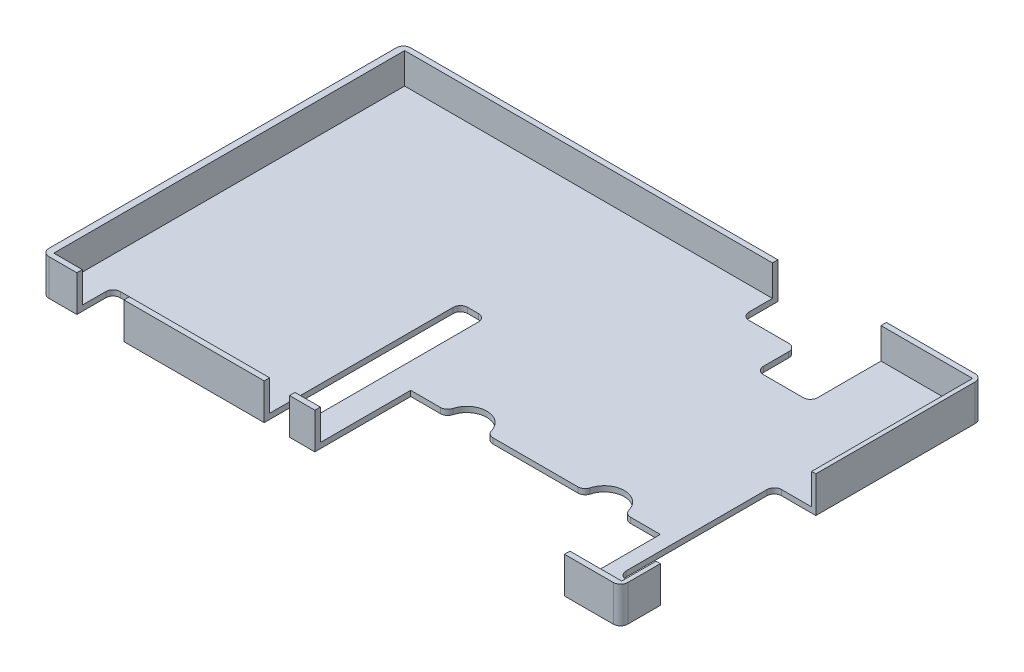
from build123d import *

# Parameters (mm, degrees)
SKETCH1_W           = 160
SKETCH1_H           = 100
BOSS_EXTRUDE1_DEPTH = 1.5
SKETCH2_W           = 160
SKETCH2_H           = 100
SKETCH2_W_2         = 157
SKETCH2_H_2         = 97
BOSS_EXTRUDE2_DEPTH = 10
FILLET1_R           = 2
SKETCH4_W           = 15
SKETCH4_H           = 21
CUT_EXTRUDE1_DEPTH  = 189.944436277
SKETCH5_W           = 69
SKETCH5_H           = 26.5
CUT_EXTRUDE2_DEPTH  = 189.944436277
SKETCH6_W           = 11.5
SKETCH6_H           = 43
CUT_EXTRUDE3_DEPTH  = 189.944436277
SKETCH7_W           = 7
SKETCH7_H           = 55
CUT_EXTRUDE4_DEPTH  = 10
CUT_EXTRUDE5_DEPTH  = 10
FILLET2_R           = 2
SKETCH10_W          = 13
SKETCH10_H          = 10
CUT_EXTRUDE6_DEPTH  = 10
FILLET3_R           = 2
FILLET4_R           = 2
SKETCH11_W          = 15
SKETCH11_H          = 10
CUT_EXTRUDE7_DEPTH  = 10
FILLET5_R           = 2


with BuildPart() as part:
    # Sketch1 → Boss-Extrude1 (new body)
    with BuildSketch(Plane(origin=(0, 0, 0), x_dir=(1, 0, 0), z_dir=(0, 1, 0))):
        with Locations((80, 50)):
            Rectangle(SKETCH1_W, SKETCH1_H)
    extrude(amount=BOSS_EXTRUDE1_DEPTH)

    # Sketch2 → Boss-Extrude2 (add)
    with BuildSketch(Plane(origin=(0, 0, 0), x_dir=(1, 0, 0), z_dir=(0, 1, 0))):
        with Locations((80, 50)):
            Rectangle(SKETCH2_W, SKETCH2_H)
        with Locations((80.326409395, 50)):
            Rectangle(SKETCH2_W_2, SKETCH2_H_2, mode=Mode.SUBTRACT)
    extrude(amount=BOSS_EXTRUDE2_DEPTH)

    # Fillet1
    fillet1_edges = [part.edges().sort_by_distance(p)[0] for p in [
        (0, 5, -100),
        (160, 5, -100),
        (160, 5, 0),
        (0, 5, 0),
    ]]
    fillet(fillet1_edges, radius=FILLET1_R)

    # Sketch4 → Cut-Extrude1 (cut, through all)
    with BuildSketch(Plane.XZ):
        with Locations((126, -89.5)):
            Rectangle(SKETCH4_W, SKETCH4_H)
    extrude(amount=-CUT_EXTRUDE1_DEPTH, mode=Mode.SUBTRACT)

    # Sketch5 → Cut-Extrude2 (cut, through all)
    with BuildSketch(Plane.XZ):
        with Locations((110, -13.25)):
            Rectangle(SKETCH5_W, SKETCH5_H)
    extrude(amount=-CUT_EXTRUDE2_DEPTH, mode=Mode.SUBTRACT)

    # Sketch6 → Cut-Extrude3 (cut, through all)
    with BuildSketch(Plane.XZ):
        with Locations((154.25, -32.5)):
            Rectangle(SKETCH6_W, SKETCH6_H)
    extrude(amount=-CUT_EXTRUDE3_DEPTH, mode=Mode.SUBTRACT)

    # Sketch7 → Cut-Extrude4 (cut)
    with BuildSketch(Plane.XZ):
        with Locations((65, -26.75)):
            Rectangle(SKETCH7_W, SKETCH7_H)
    extrude(amount=-CUT_EXTRUDE4_DEPTH, mode=Mode.SUBTRACT)

    # Sketch9 → Cut-Extrude5 (cut)
    with BuildSketch(Plane.XZ):
        with BuildLine():
            Line((134.539408017, -26.5), (123.460591983, -26.5))
            ThreePointArc((123.460591983, -26.5), (129, -32.039408017), (134.539408017, -26.5))
        make_face()
        with BuildLine():
            Line((96.539, -26.5), (85.461, -26.5))
            ThreePointArc((85.461, -26.5), (91, -32.039), (96.539, -26.5))
        make_face()
    extrude(amount=-CUT_EXTRUDE5_DEPTH, mode=Mode.SUBTRACT)

    # Fillet2
    fillet2_edges = [part.edges().sort_by_distance(p)[0] for p in [
        (96.539, 0.75, -26.5),
        (85.461, 0.75, -26.5),
        (123.460591983, 0.75, -26.5),
        (134.539408017, 0.75, -26.5),
    ]]
    fillet(fillet2_edges, radius=FILLET2_R)

    # Sketch10 → Cut-Extrude6 (cut)
    with BuildSketch(Plane.XZ):
        with Locations((16.208817875, -5)):
            Rectangle(SKETCH10_W, SKETCH10_H)
    extrude(amount=-CUT_EXTRUDE6_DEPTH, mode=Mode.SUBTRACT)

    # Fillet3
    fillet3_edges = [part.edges().sort_by_distance(p)[0] for p in [
        (68.5, 0.75, -54.25),
        (61.5, 0.75, -54.25),
        (9.708817875, 0.75, -10),
        (22.708817875, 0.75, -10),
    ]]
    fillet(fillet3_edges, radius=FILLET3_R)

    # Fillet4
    fillet4_edges = [part.edges().sort_by_distance(p)[0] for p in [
        (148.5, 0.75, -11),
        (148.5, 0.75, -54),
        (133.5, 0.75, -79),
        (118.5, 0.75, -79),
    ]]
    fillet(fillet4_edges, radius=FILLET4_R)

    # Sketch11 → Cut-Extrude7 (cut)
    with BuildSketch(Plane.XZ):
        with Locations((111, -95)):
            Rectangle(SKETCH11_W, SKETCH11_H)
    extrude(amount=-CUT_EXTRUDE7_DEPTH, mode=Mode.SUBTRACT)

    # Fillet5
    fillet5_edges = [part.edges().sort_by_distance(p)[0] for p in [
        (118.5, 0.75, -90),
        (103.5, 0.75, -90),
    ]]
    fillet(fillet5_edges, radius=FILLET5_R)


solid = part.part
